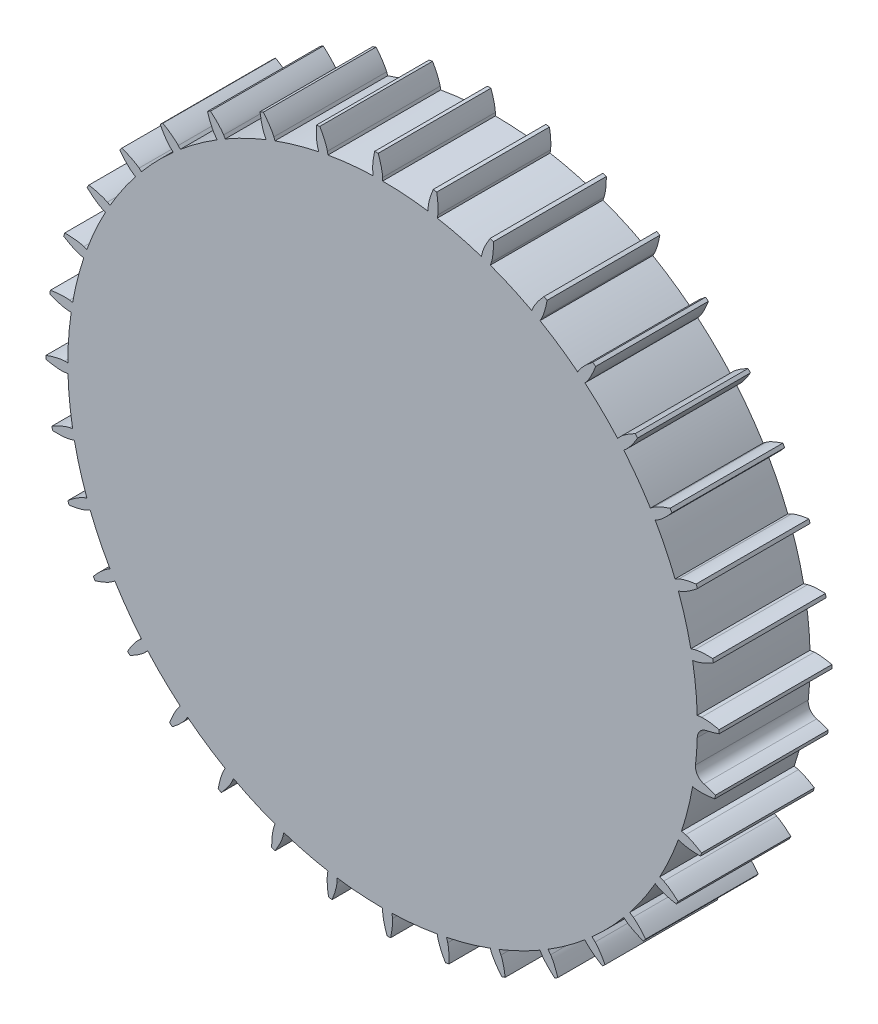
from build123d import *

# Parameters (mm, degrees)
SKETCH1_R           = 75.837911037
BOSS_EXTRUDE1_DEPTH = 25.4
CUT_EXTRUDE4_START  = -25.4
CUT_EXTRUDE4_DEPTH  = 25.4
FILLET1_R           = 2.54
CIRPATTERN1_COUNT   = 36


# Read off the part's stored shape, not the designer's step: Cut-Extrude4
with BuildPart() as part:
    # Sketch1 → Boss-Extrude1 (new body)
    with BuildSketch(Plane.XY):
        Circle(SKETCH1_R)
    extrude(amount=-BOSS_EXTRUDE1_DEPTH)

    # Cut-Extrude4 outline → Cut-Extrude4 (cut)
    with BuildSketch(Plane.XY.offset(CUT_EXTRUDE4_START)):
        with BuildLine():
            add(Edge.make_bspline(
                [(71.604577704, 0), (71.629055997, 0.000352159), (71.697694838, 0.002430906), (71.82736462, 0.010664806), (72.038680932, 0.03021725), (72.307395137, 0.064094446), (72.653912093, 0.118183171), (73.060826443, 0.195081599), (73.506484695, 0.293430933), (73.989292353, 0.415216081), (74.469126079, 0.549900899), (74.945590436, 0.696253852), (75.345242972, 0.828870526), (75.625098328, 0.926967877), (75.786814843, 0.985339472), (75.831297652, 1.001522269)],
                knots=[0, 0, 0, 0, 0, 0.005376749, 0.015083688, 0.02853182, 0.04661014, 0.064854849, 0.092110525, 0.119476176, 0.146842496, 0.174208854, 0.201574956, 0.228941013, 0.23933816, 0.23933816, 0.23933816, 0.23933816, 0.23933816], degree=4))
            Line((71.604577704, 0), (70.908333333, 0))
            ThreePointArc((70.908333333, 0), (70.722766723, -5.126597623), (70.167038144, -10.226362706))
            Line((70.167038144, -10.226362706), (71.131515881, -10.281840438))
            add(Edge.make_bspline(
                [(74.977560698, -11.390967577), (74.89797731, -11.358034324), (74.702887358, -11.27839638), (74.390968003, -11.155418009), (73.95975841, -10.995333668), (73.488450946, -10.833316139), (73.013433681, -10.684006212), (72.574158689, -10.56022677), (72.172331821, -10.460087744), (71.829492804, -10.386189166), (71.563167477, -10.336936671), (71.353322707, -10.305281424), (71.224339752, -10.289614685), (71.155933556, -10.283597708), (71.131515881, -10.281840438)],
                knots=[0.688598358, 0.688598358, 0.688598358, 0.688598358, 0.688598358, 0.707515959, 0.734882061, 0.762248419, 0.789614739, 0.816980389, 0.844236066, 0.862480775, 0.880559095, 0.894007227, 0.903714166, 0.909090915, 0.909090915, 0.909090915, 0.909090915, 0.909090915], degree=4))
            ThreePointArc((74.977560698, -11.390967577), (75.658584379, -5.212231782), (75.831297652, 1.001522269))
        make_face()
    cut_extrude4 = extrude(amount=CUT_EXTRUDE4_DEPTH, mode=Mode.SUBTRACT)

    # Fillet1
    fillet1_edges = [part.edges().sort_by_distance(p)[0] for p in [
        (70.908333333, 0, -12.7),
        (70.167038144, -10.226362706, -12.7),
    ]]
    fillet(fillet1_edges, radius=FILLET1_R)

    # CirPattern1: Cut-Extrude4 ×36 about axis
    cirpattern1_axis = Axis((0, 0, -25.4), (0, 0, 1))
    for i in range(1, CIRPATTERN1_COUNT):
        add(cut_extrude4.rotate(cirpattern1_axis, i * 360 / CIRPATTERN1_COUNT), mode=Mode.SUBTRACT)


solid = part.part
